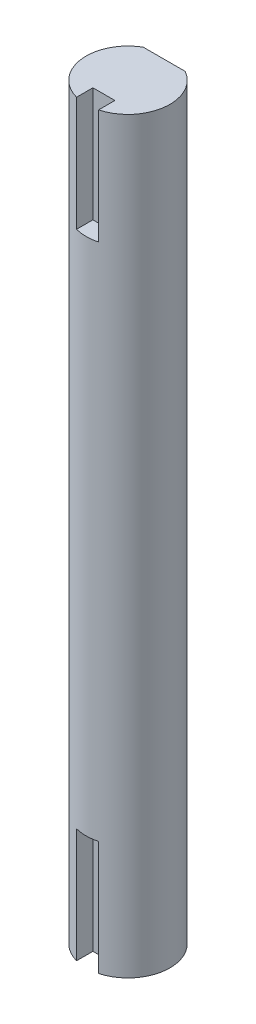
from build123d import *

# Parameters (mm, degrees)
BOSS_EXTRUDE1_DEPTH      = 42.5
BOSS_EXTRUDE1_DEPTH_BACK = 42.5
CUT_EXTRUDE1_DEPTH       = 86.266422538
CUT_EXTRUDE1_DEPTH_BACK  = 13
CUT_EXTRUDE2_START       = -13
CUT_EXTRUDE2_DEPTH       = 13


with BuildPart() as part:
    # Sketch1 → Boss-Extrude1 (new, two sides: drawn at the far end of the back side and taken through both)
    with BuildSketch(Plane(origin=(0, 0, 0), x_dir=(1, 0, 0), z_dir=(0, 1, 0)).offset(-BOSS_EXTRUDE1_DEPTH_BACK)):
        with BuildLine():
            Line((2.3876, 4.120773288), (-2.3876, 4.120773288))
            ThreePointArc((-2.3876, 4.120773288), (-2.378072881, -4.126278665), (4.7625, 0))
            ThreePointArc((4.7625, 0), (4.126278665, 2.378072881), (2.3876, 4.120773288))
        make_face()
    extrude(amount=BOSS_EXTRUDE1_DEPTH + BOSS_EXTRUDE1_DEPTH_BACK)

    # Sketch2 → Cut-Extrude1 (cut, two sides: drawn at the far end of the back side and taken through both)
    with BuildSketch(Plane.XZ.offset(42.5).offset(-CUT_EXTRUDE1_DEPTH_BACK)):
        Polygon((-1.25, 35.773266476), (-1.25, 4.595531117), (-1.25, 2.7375), (1.25, 2.7375), (1.25, 4.595531117), (1.25, 35.773266476), (1.25, 98.128737194), (-1.25, 98.128737194), align=None)
    extrude(amount=CUT_EXTRUDE1_DEPTH + CUT_EXTRUDE1_DEPTH_BACK, mode=Mode.SUBTRACT)

    # Sketch3 → Cut-Extrude2 (cut)
    with BuildSketch(Plane(origin=(0, 42.5, 0), x_dir=(1, 0, 0), z_dir=(0, 1, 0)).offset(CUT_EXTRUDE2_START)):
        with BuildLine():
            Line((-1.25, -4.595531117), (-1.25, -2.7375))
            Line((-1.25, -2.7375), (1.25, -2.7375))
            Line((1.25, -2.7375), (1.25, -4.595531117))
            ThreePointArc((1.25, -4.595531117), (0, -4.7625), (-1.25, -4.595531117))
        make_face()
    extrude(amount=CUT_EXTRUDE2_DEPTH, mode=Mode.SUBTRACT)


solid = part.part
